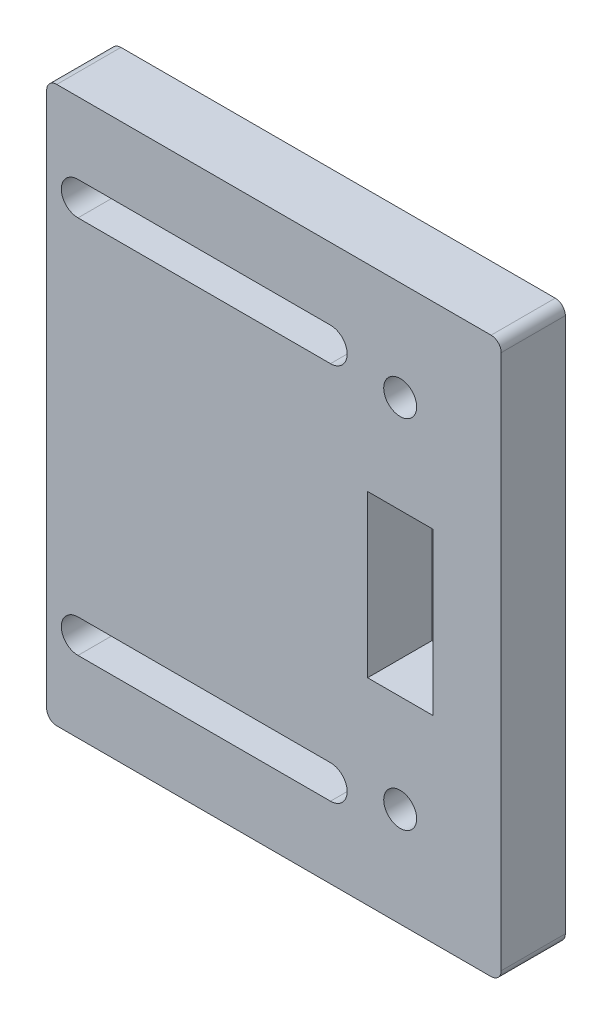
from build123d import *

# Parameters (mm, degrees)
SKETCH1_W                                        = 90
SKETCH1_H                                        = 110
BOSS_EXTRUDE2_DEPTH                              = 12.7
CSK_FOR_1_4_FLAT_HEAD_MACHINE_SCREW3_D           = 6.5278
CSK_FOR_1_4_FLAT_HEAD_MACHINE_SCREW3_CSINK_D     = 12.8778
CSK_FOR_1_4_FLAT_HEAD_MACHINE_SCREW3_CSINK_ANGLE = 82
CSK_FOR_1_4_FLAT_HEAD_MACHINE_SCREW4_D           = 6.5278
CSK_FOR_1_4_FLAT_HEAD_MACHINE_SCREW4_CSINK_D     = 12.8778
CSK_FOR_1_4_FLAT_HEAD_MACHINE_SCREW4_CSINK_ANGLE = 82
FILLET1_R                                        = 2
CUT_EXTRUDE1_DEPTH                               = 143.692992119


with BuildPart() as part:
    # Sketch1 → Boss-Extrude2 (new body)
    with BuildSketch(Plane.XY):
        with Locations((45, -55)):
            Rectangle(SKETCH1_W, SKETCH1_H)
        Polygon((70, -39.025625978), (76.45, -39.025625978), (76.45, -55.000625978), (76.45, -70.975625978), (70, -70.975625978), (63.55, -70.975625978), (63.55, -39.025625978), align=None, mode=Mode.SUBTRACT)
    extrude(amount=BOSS_EXTRUDE2_DEPTH)

    # CSK for 1/4 Flat Head Machine Screw3 (through all)
    with Locations(Plane(origin=(0, 0, 0), x_dir=(-1, 0, 0), z_dir=(0, 0, -1))):
        with Locations((-70, -90.31)):
            CounterSinkHole(CSK_FOR_1_4_FLAT_HEAD_MACHINE_SCREW3_D / 2, CSK_FOR_1_4_FLAT_HEAD_MACHINE_SCREW3_CSINK_D / 2, counter_sink_angle=CSK_FOR_1_4_FLAT_HEAD_MACHINE_SCREW3_CSINK_ANGLE)

    # CSK for 1/4 Flat Head Machine Screw4 (through all)
    with Locations(Plane(origin=(0, 0, 0), x_dir=(-1, 0, 0), z_dir=(0, 0, -1))):
        with Locations((-70, -19.69)):
            CounterSinkHole(CSK_FOR_1_4_FLAT_HEAD_MACHINE_SCREW4_D / 2, CSK_FOR_1_4_FLAT_HEAD_MACHINE_SCREW4_CSINK_D / 2, counter_sink_angle=CSK_FOR_1_4_FLAT_HEAD_MACHINE_SCREW4_CSINK_ANGLE)

    # Fillet1
    fillet1_edges = [part.edges().sort_by_distance(p)[0] for p in [
        (0, 0, 6.35),
        (90, 0, 6.35),
        (0, -110, 6.35),
        (90, -110, 6.35),
    ]]
    fillet(fillet1_edges, radius=FILLET1_R)

    # Sketch15 → Cut-Extrude1 (cut, through all)
    with BuildSketch(Plane(origin=(0, 0, 0), x_dir=(-1, 0, 0), z_dir=(0, 0, -1))):
        with BuildLine():
            Line((-56.200253658, -14.185), (-6.200253658, -14.185))
            ThreePointArc((-6.200253658, -14.185), (-2.900253658, -17.485), (-6.200253658, -20.785))
            Line((-6.200253658, -20.785), (-56.200253658, -20.785))
            ThreePointArc((-56.200253658, -20.785), (-59.500253658, -17.485), (-56.200253658, -14.185))
        make_face()
        with BuildLine():
            Line((-56.200253658, -89.215), (-6.200253658, -89.215))
            ThreePointArc((-6.200253658, -89.215), (-2.900253658, -92.515), (-6.200253658, -95.815))
            Line((-6.200253658, -95.815), (-56.200253658, -95.815))
            ThreePointArc((-56.200253658, -95.815), (-59.500253658, -92.515), (-56.200253658, -89.215))
        make_face()
    extrude(amount=-CUT_EXTRUDE1_DEPTH, mode=Mode.SUBTRACT)


solid = part.part
